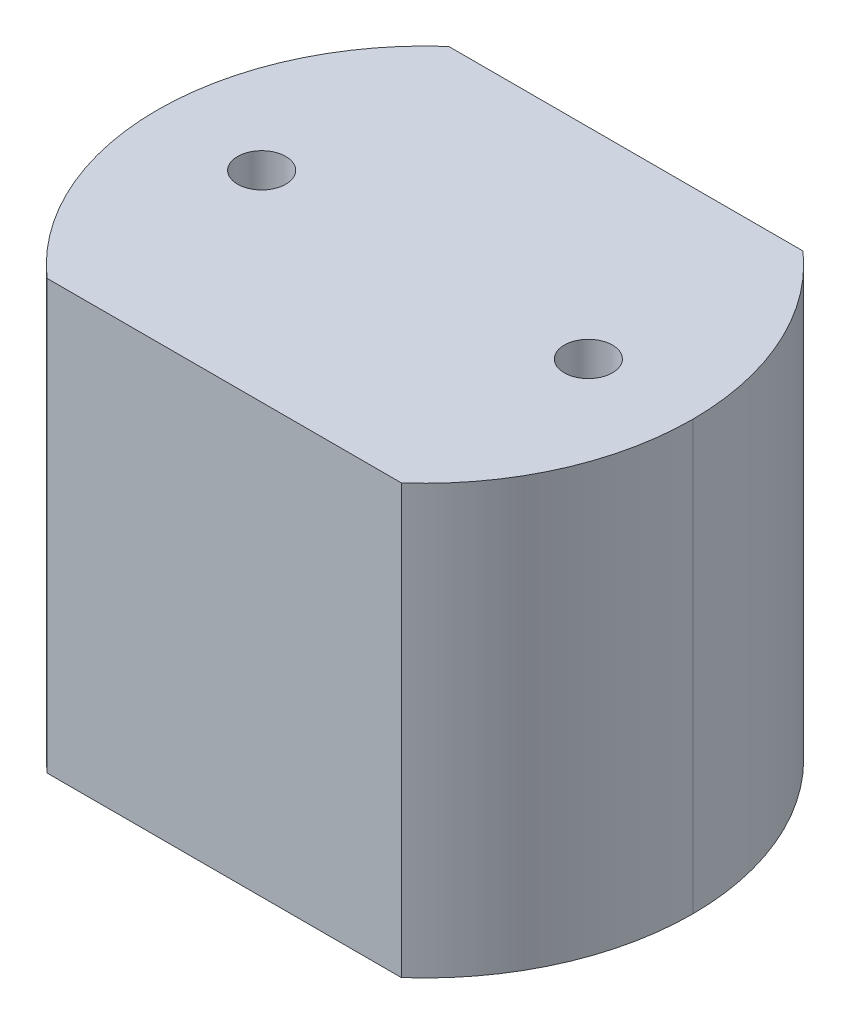
from build123d import *

# Parameters (mm, degrees)
SKETCH1_W                = 25.4
SKETCH1_H                = 25.4
BOSS_EXTRUDE1_DEPTH      = 20.32
SKETCH2_R                = 1.143
CUT_EXTRUDE1_DEPTH       = 28.11977876
FILLET1_R                = 12.7
CUT_EXTRUDE2_START       = -12.7
CUT_EXTRUDE2_OUTLINE_W   = 20
CUT_EXTRUDE2_OUTLINE_H   = 20.32
CUT_EXTRUDE2_DEPTH       = 3.175
CUT_EXTRUDE2_START_2     = 9.525
CUT_EXTRUDE2_2_OUTLINE_W = 20
CUT_EXTRUDE2_2_OUTLINE_H = 20.32
CUT_EXTRUDE2_2_DEPTH     = 3.175


# Read off the part's stored shape, not the designer's step: Cut-Extrude2
with BuildPart() as part:
    # Sketch1 → Boss-Extrude1 (new body)
    with BuildSketch(Plane(origin=(0, 0, 0), x_dir=(1, 0, 0), z_dir=(0, 1, 0))):
        Rectangle(SKETCH1_W, SKETCH1_H)
    extrude(amount=BOSS_EXTRUDE1_DEPTH)

    # Sketch2 → Cut-Extrude1 (cut, through all)
    with BuildSketch(Plane(origin=(0, 20.32, 0), x_dir=(1, 0, 0), z_dir=(0, 1, 0))):
        with Locations(Location((-7.747, 0, 0), (0, 0, 270))):
            Circle(SKETCH2_R)
        with Locations(Location((7.747, 0, 0), (0, 0, 90))):
            Circle(SKETCH2_R)
    extrude(amount=-CUT_EXTRUDE1_DEPTH, mode=Mode.SUBTRACT)

    # Fillet1
    fillet1_edges = [part.edges().sort_by_distance(p)[0] for p in [
        (-12.7, 10.16, -12.7),
        (12.7, 10.16, -12.7),
        (12.7, 10.16, 12.7),
        (-12.7, 10.16, 12.7),
    ]]
    fillet(fillet1_edges, radius=FILLET1_R - 0.0001)  # a hair under: the kernel refuses the full size

    # Cut-Extrude2 outline → Cut-Extrude2 (cut)
    with BuildSketch(Plane.XY.offset(CUT_EXTRUDE2_START)):
        with Locations((0, 10.16)):
            Rectangle(CUT_EXTRUDE2_OUTLINE_W, CUT_EXTRUDE2_OUTLINE_H)
    extrude(amount=CUT_EXTRUDE2_DEPTH, mode=Mode.SUBTRACT)

    # Cut-Extrude2 2 outline → Cut-Extrude2 2 (cut)
    with BuildSketch(Plane.XY.offset(CUT_EXTRUDE2_START_2)):
        with Locations((0, 10.16)):
            Rectangle(CUT_EXTRUDE2_2_OUTLINE_W, CUT_EXTRUDE2_2_OUTLINE_H)
    extrude(amount=CUT_EXTRUDE2_2_DEPTH, mode=Mode.SUBTRACT)


solid = part.part
